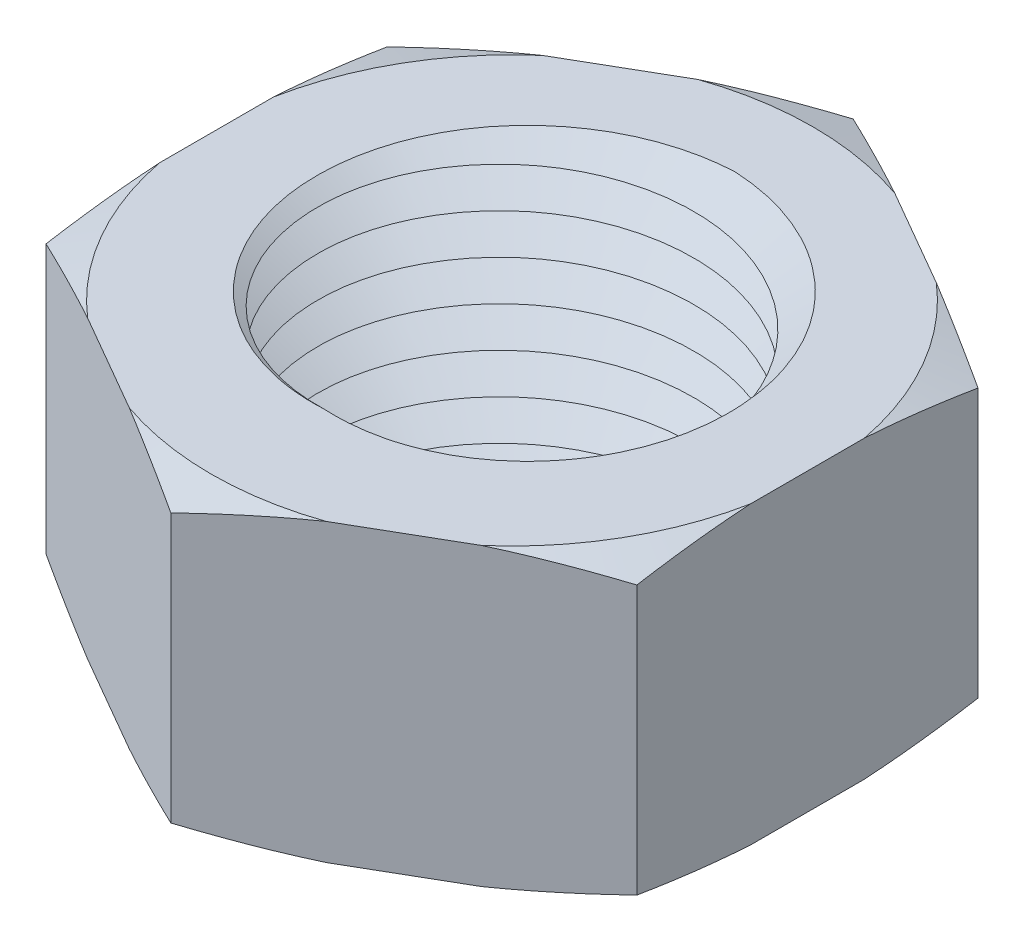
from build123d import *

# Parameters (mm, degrees)
SKETCH_1_R      = 7
EXTRUDE_1_DEPTH = 5.5
SWEEP_5_PITCH   = 1.5


with BuildPart() as part:
    # 草图1 → 凸台-拉伸1 (new, symmetric)
    with BuildSketch(Plane(origin=(0, 0, 0), x_dir=(1, 0, 0), z_dir=(0, 1, 0))):
        Polygon((0, 12.701705922), (-11, 6.350852961), (-11, -6.350852961), (0, -12.701705922), (11, -6.350852961), (11, 6.350852961), align=None)
        with Locations(Location((0, 0, 0), (0, 0, 270))):
            Circle(SKETCH_1_R, mode=Mode.SUBTRACT)
    extrude(amount=EXTRUDE_1_DEPTH, both=True)

    # 草图2 → 切除-旋转1 (revolve, cut)
    with BuildSketch(Plane(origin=(0, 0, 0), x_dir=(0.8660254037844416, 0, 0.499999999999995), z_dir=(-0.49999999999999495, 0, 0.8660254037844415))):
        Polygon((11.201705922, 5.5), (12.701705922, 5.5), (12.701705922, 5), align=None)
        Polygon((12.701705922, -5), (11.201705922, -5.5), (12.701705922, -5.5), align=None)
    revolve(axis=Axis((0, 0, 0), (0, 1, 0)), mode=Mode.SUBTRACT)

    # 切除-扫描5: arcs per turn and ends read off the stored shape
    # 切除-扫描5: the profile of 草图5 profile screwed along a right-hand helix through 10 turns, 8 arcs to a turn; built about Z, then put on its axis
    sweep_5_z = Axis((0, 0, 0), (0, 0, 1))
    sweep_5_corners = [(6.9997, 0, -2.250673205), (6.9997, 0, -0.749326795), (8.299904131, 0, -1.5)]
    with BuildLine(mode=Mode.PRIVATE) as sweep_5_profile:
        Line(sweep_5_corners[0], sweep_5_corners[1])
        Line(sweep_5_corners[1], sweep_5_corners[2])
        Line(sweep_5_corners[2], sweep_5_corners[0])
    sweep_5_cap = Face(sweep_5_profile.wire())
    sweep_5_turn_angles = [0, 22.5, 45, 67.5, 90, 112.5, 135, 157.5, 180, 202.5, 225, 247.5, 270, 292.5, 315, 337.5, 360]
    sweep_5_turn_weights = [1, 0.9238795325112867, 1, 0.9238795325112867, 1, 0.9238795325112867, 1, 0.9238795325112867, 1, 0.9238795325112867, 1, 0.9238795325112867, 1, 0.9238795325112867, 1, 0.9238795325112867, 1]
    sweep_5_turn_rails = [Edge.make_bspline([Vector(p[0], p[1], 0).rotate(sweep_5_z, sweep_5_turn_angles[k]) / sweep_5_turn_weights[k] + Vector(0, 0, p[2] + SWEEP_5_PITCH * sweep_5_turn_angles[k] / 360) for k in range(17)], [0, 0, 0, 1, 1, 2, 2, 3, 3, 4, 4, 5, 5, 6, 6, 7, 7, 8, 8, 8], 2, sweep_5_turn_weights) for p in sweep_5_corners]
    sweep_5_turn_sides = [Face.make_surface_from_curves(sweep_5_turn_rails[p[0]], sweep_5_turn_rails[p[1]]) for p in [(0, 1), (1, 2), (2, 0)]]
    sweep_5_turn = Solid(Shell([*sweep_5_turn_sides, sweep_5_cap, sweep_5_cap.rotate(sweep_5_z, 360).moved(Location((0, 0, SWEEP_5_PITCH * 360 / 360)))]))
    sweep_5_each = [*[sweep_5_turn.moved(Location((0, 0, SWEEP_5_PITCH * i))) for i in range(10)]]
    add(Plane(origin=(0, 5.5, 0), x_dir=(0, 0, -1), z_dir=(0, -1, 0)) * Compound([sweep_5_each[i] for i in range(0, 10, 2)]), mode=Mode.SUBTRACT)
    add(Plane(origin=(0, 5.5, 0), x_dir=(0, 0, -1), z_dir=(0, -1, 0)) * Compound([sweep_5_each[i] for i in range(1, 10, 2)]), mode=Mode.SUBTRACT)


solid = part.part
